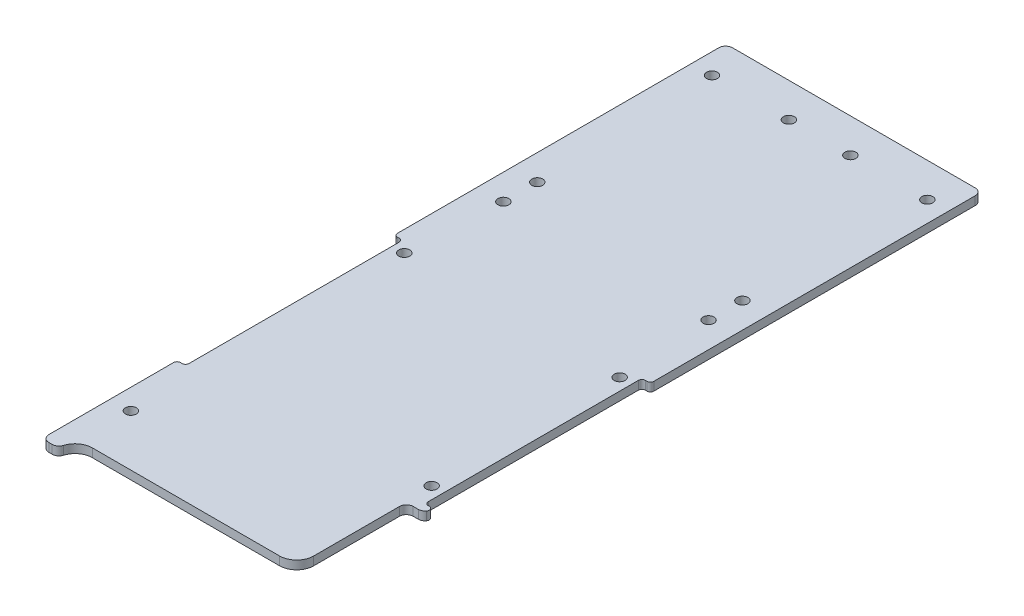
from build123d import *

# Parameters (mm, degrees)
SKETCH1_R               = 2.032
BOSS_EXTRUDE1_DEPTH     = 3.175
FILLET1_R               = 2.54
FILLET2_R               = 2.54
FILLET3_R               = 6.35
CUT_EXTRUDE1_DEPTH      = 136.673215063
FILLET4_R               = 6.35
FILLET5_R               = 2.54
SKETCH3_R               = 2.032
CUT_EXTRUDE2_DEPTH      = 136.673215063
CUT_EXTRUDE3_DEPTH      = 136.673215063
CUT_EXTRUDE3_DEPTH_BACK = 136.673215063
SKETCH4_W               = 3.175
SKETCH4_H               = 80.645
FILLET6_R               = 1.27


with BuildPart() as part:
    # Sketch1 → Boss-Extrude1 (new body)
    with BuildSketch(Plane(origin=(0, 0, 0), x_dir=(1, 0, 0), z_dir=(0, 1, 0))):
        Polygon((47.625, 127), (-47.625, 127), (-47.625, -127), (-41.275, -127), (-41.275, -120.65), (41.275, -120.65), (41.275, -127), (47.625, -127), align=None)
        with Locations((-39.999684148, -101.6)):
            Circle(SKETCH1_R, mode=Mode.SUBTRACT)
        with Locations((39.999684148, -69.85)):
            Circle(SKETCH1_R, mode=Mode.SUBTRACT)
        with Locations((-39.999684148, 0)):
            Circle(SKETCH1_R, mode=Mode.SUBTRACT)
        with Locations((-39.999684148, 114.3)):
            Circle(SKETCH1_R, mode=Mode.SUBTRACT)
        with Locations((-11.424684148, 114.3)):
            Circle(SKETCH1_R, mode=Mode.SUBTRACT)
        with Locations((39.999684148, 0)):
            Circle(SKETCH1_R, mode=Mode.SUBTRACT)
        with Locations((11.424684148, 114.3)):
            Circle(SKETCH1_R, mode=Mode.SUBTRACT)
        with Locations((39.999684148, 114.3)):
            Circle(SKETCH1_R, mode=Mode.SUBTRACT)
    extrude(amount=BOSS_EXTRUDE1_DEPTH)

    # Fillet1
    fillet1_edges = [part.edges().sort_by_distance(p)[0] for p in [
        (-47.625, 1.5875, -127),
        (47.625, 1.5875, -127),
        (47.625, 1.5875, 127),
        (-47.625, 1.5875, 127),
    ]]
    fillet(fillet1_edges, radius=FILLET1_R)

    # Fillet2
    fillet2_edges = [part.edges().sort_by_distance(p)[0] for p in [
        (41.275, 1.5875, 127),
        (-41.275, 1.5875, 127),
    ]]
    fillet(fillet2_edges, radius=FILLET2_R)

    # Fillet3
    fillet3_edges = [part.edges().sort_by_distance(p)[0] for p in [
        (41.275, 1.5875, 120.65),
        (-41.275, 1.5875, 120.65),
    ]]
    fillet(fillet3_edges, radius=FILLET3_R)

    # Sketch2 → Cut-Extrude1 (cut, through all)
    with BuildSketch(Plane.XZ):
        with BuildLine():
            Line((40.64508, 123.578690235), (40.64508, 79.88808))
            Line((40.64508, 79.88808), (47.625, 79.88808))
            Line((47.625, 79.88808), (47.625, 124.46))
            ThreePointArc((47.625, 124.46), (46.881051224, 126.256051224), (45.085, 127))
            Line((45.085, 127), (43.815, 127))
            ThreePointArc((43.815, 127), (42.297059666, 126.496530663), (41.380880287, 125.185714286))
            ThreePointArc((41.380880287, 125.185714286), (41.069166069, 124.356476684), (40.64508, 123.578690235))
        make_face()
    extrude(amount=-CUT_EXTRUDE1_DEPTH, mode=Mode.SUBTRACT)

    # Fillet4
    fillet4_edges = [part.edges().sort_by_distance(p)[0] for p in [
        (40.64508, 1.5875, 123.578690235),
    ]]
    fillet(fillet4_edges, radius=FILLET4_R)

    # Fillet5
    fillet5_edges = [part.edges().sort_by_distance(p)[0] for p in [
        (47.625, 1.5875, 79.88808),
        (40.64508, 1.5875, 79.88808),
    ]]
    fillet(fillet5_edges, radius=FILLET5_R)

    # Sketch3 → Cut-Extrude2 (cut, through all)
    with BuildSketch(Plane.XZ):
        with Locations((-38.105774661, -34.913768806)):
            Circle(SKETCH3_R)
        with Locations((-38.105774661, -47.490173279)):
            Circle(SKETCH3_R)
        with Locations((38.105774661, -47.490173279)):
            Circle(SKETCH3_R)
        with Locations((38.105774661, -34.913768806)):
            Circle(SKETCH3_R)
    extrude(amount=-CUT_EXTRUDE2_DEPTH, mode=Mode.SUBTRACT)

    # Sketch4 → Cut-Extrude3 (cut, two sides: drawn at the far end of the back side and taken through both)
    with BuildSketch(Plane(origin=(0, 3.175, 0), x_dir=(1, 0, 0), z_dir=(0, 1, 0)).offset(-CUT_EXTRUDE3_DEPTH_BACK)):
        with Locations((-46.0375, -36.5125)):
            Rectangle(SKETCH4_W, SKETCH4_H)
        with Locations((46.0375, -36.5125)):
            Rectangle(SKETCH4_W, SKETCH4_H)
    extrude(amount=CUT_EXTRUDE3_DEPTH + CUT_EXTRUDE3_DEPTH_BACK, mode=Mode.SUBTRACT)

    # Fillet6
    fillet6_edges = [part.edges().sort_by_distance(p)[0] for p in [
        (-44.45, 1.5875, -3.81),
        (-47.625, 1.5875, -3.81),
        (-47.625, 1.5875, 76.835),
        (-44.45, 1.5875, 76.835),
        (44.45, 1.5875, 76.835),
        (47.625, 1.5875, 76.835),
        (44.45, 1.5875, -3.81),
        (47.625, 1.5875, -3.81),
    ]]
    fillet(fillet6_edges, radius=FILLET6_R)


solid = part.part
